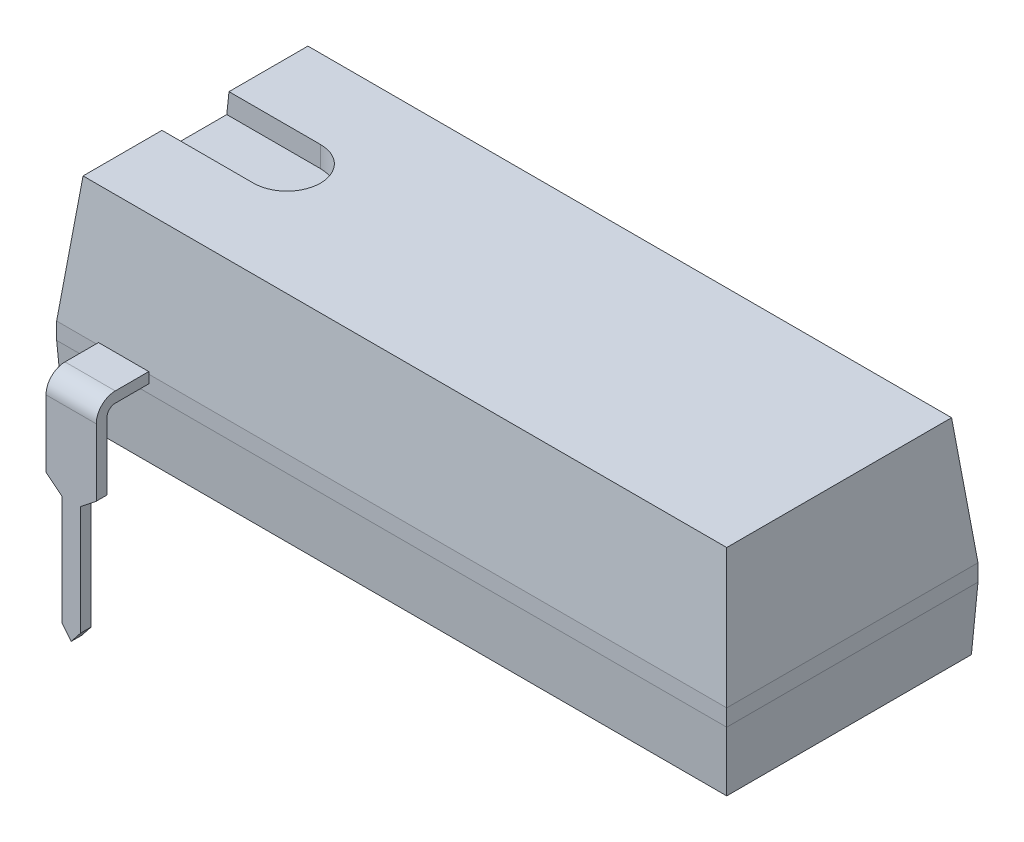
from build123d import *

# Parameters (mm, degrees)
SKETCH_1_W          = 16
SKETCH_1_H          = 6
EXTRUDE_1_DEPTH     = 0.4
SKETCH_2_W          = 16
SKETCH_2_H          = 6
EXTRUDE_2_DEPTH     = 3
EXTRUDE_2_TAPER     = 6
SKETCH_3_W          = 16
SKETCH_3_H          = 6
EXTRUDE_3_DEPTH     = 1.5
EXTRUDE_3_TAPER     = 3
CUT_EXTRUDE_4_DEPTH = 0.5
EXTRUDE_1_2_DEPTH   = 1.2
CUT_EXTRUDE_START   = -0.254
CUT_EXTRUDE_5_DEPTH = 0.254


# Read off the part's stored shape, not the designer's step: 伸長-薄件1
with BuildPart() as part:
    # 草圖1 → Extrude 1 (new body)
    with BuildSketch(Plane(origin=(0, 0, 0), x_dir=(1, 0, 0), z_dir=(0, 1, 0))):
        with Locations((7, 0)):
            Rectangle(SKETCH_1_W, SKETCH_1_H)
    extrude(amount=EXTRUDE_1_DEPTH)

    # 草圖2 → 伸長2 (add)
    with BuildSketch(Plane(origin=(0, 0.4, 0), x_dir=(1, 0, 0), z_dir=(0, 1, 0))):
        with Locations((7, 0)):
            Rectangle(SKETCH_2_W, SKETCH_2_H)
    extrude(amount=EXTRUDE_2_DEPTH, taper=EXTRUDE_2_TAPER)

    # 草圖3 → 伸長3 (add)
    with BuildSketch(Plane(origin=(0, 0, 0), x_dir=(-1, 0, 0), z_dir=(0, -1, 0))):
        with Locations((-7, 0)):
            Rectangle(SKETCH_3_W, SKETCH_3_H)
    extrude(amount=EXTRUDE_3_DEPTH, taper=EXTRUDE_3_TAPER)

    # 草圖4 → 伸長4 (cut)
    with BuildSketch(Plane(origin=(0, 3.4, 0), x_dir=(1, 0, 0), z_dir=(0, 1, 0))):
        with BuildLine():
            Line((-1, 0.8), (1.5, 0.8))
            ThreePointArc((1.5, 0.8), (2.3, 0), (1.5, -0.8))
            Line((1.5, -0.8), (-1, -0.8))
            Line((-1, -0.8), (-1, 0.8))
        make_face()
    extrude(amount=-CUT_EXTRUDE_4_DEPTH, mode=Mode.SUBTRACT)

    # Extrude 1 2 outline → Extrude 1 2 (add)
    with BuildSketch(Plane(origin=(0, 0, 0), x_dir=(0, 0, -1), z_dir=(1, 0, 0))):
        with BuildLine():
            Line((-3, 0.2), (-3, 0.454))
            Line((-3, 0.454), (-3.8, 0.454))
            ThreePointArc((-3.8, 0.454), (-4.121026479, 0.321026479), (-4.254, 0))
            Line((-4.254, 0), (-4.254, -4.8))
            Line((-4.254, -4.8), (-4, -4.8))
            Line((-4, -4.8), (-4, 0))
            ThreePointArc((-4, 0), (-3.941421356, 0.141421356), (-3.8, 0.2))
            Line((-3.8, 0.2), (-3, 0.2))
        make_face()
    extrude(amount=EXTRUDE_1_2_DEPTH)

    # 草圖6 → 伸長5 (cut)
    with BuildSketch(Plane.XY.offset(4.254).offset(CUT_EXTRUDE_START)):
        Polygon((0.6, -4.8), (0.823031072, -4.518152134), (0.823031072, -1.899802565), (1.593384633, -1.289166003), (1.593384633, -5.180880526), (-0.393384633, -5.180880526), (-0.393384633, -1.289166003), (0.376968928, -1.899802565), (0.376968928, -4.518152134), align=None)
    extrude(amount=CUT_EXTRUDE_5_DEPTH, mode=Mode.SUBTRACT)


solid = part.part
